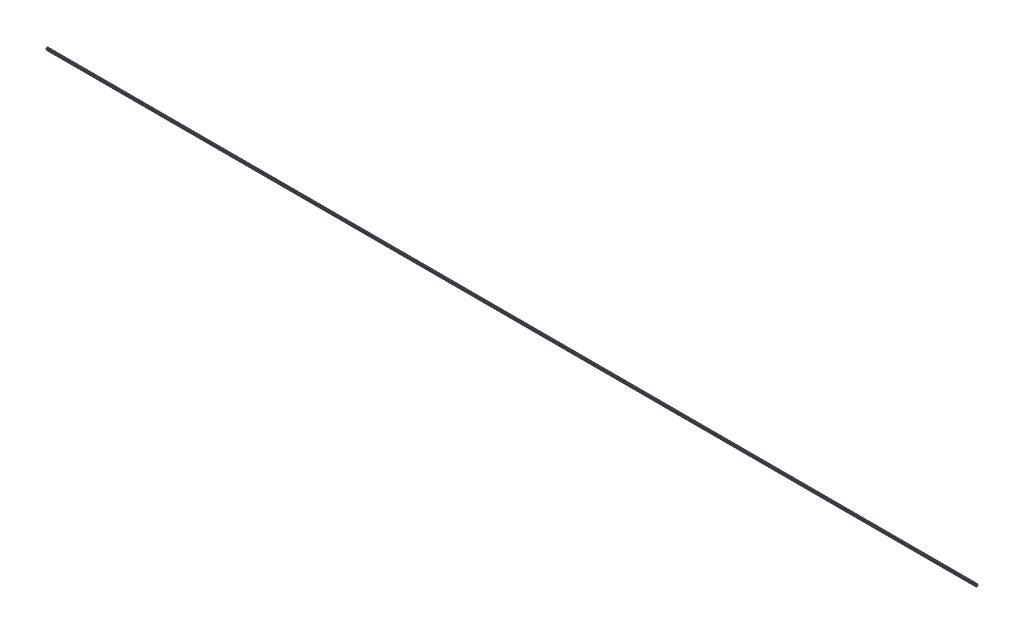
from build123d import *

# Parameters (mm, degrees)
SKETCH1_R           = 3.4
SKETCH1_R_2         = 2.1
BOSS_EXTRUDE1_DEPTH = 15000


with BuildPart() as part:
    # Sketch1 → Boss-Extrude1 (new body)
    with BuildSketch(Plane(origin=(0, 0, 0), x_dir=(0, -1, 0), z_dir=(-1, 0, 0))):
        with BuildLine():
            Line((13, -4), (13, -8.25))
            Line((13, -8.25), (9.664213562, -8.25))
            Line((9.664213562, -8.25), (6, -4.585786438))
            Line((6, -4.585786438), (6, -0.519615242))
            Line((6, -0.519615242), (5.7, 0))
            Line((5.7, 0), (6, 0.519615242))
            Line((6, 0.519615242), (6, 4.585786438))
            Line((6, 4.585786438), (9.664213562, 8.25))
            Line((9.664213562, 8.25), (13, 8.25))
            Line((13, 8.25), (13, 4))
            Line((13, 4), (15, 4))
            Line((15, 4), (15, 13))
            ThreePointArc((15, 13), (14.414213562, 14.414213562), (13, 15))
            Line((13, 15), (4, 15))
            Line((4, 15), (4, 13))
            Line((4, 13), (8.25, 13))
            Line((8.25, 13), (8.25, 9.664213562))
            Line((8.25, 9.664213562), (4.585786438, 6))
            Line((4.585786438, 6), (0.519615242, 6))
            Line((0.519615242, 6), (0, 5.7))
            Line((0, 5.7), (-0.519615242, 6))
            Line((-0.519615242, 6), (-4.585786438, 6))
            Line((-4.585786438, 6), (-8.25, 9.664213562))
            Line((-8.25, 9.664213562), (-8.25, 13))
            Line((-8.25, 13), (-4, 13))
            Line((-4, 13), (-4, 15))
            Line((-4, 15), (-13, 15))
            ThreePointArc((-13, 15), (-14.414213562, 14.414213562), (-15, 13))
            Line((-15, 13), (-15, 4))
            Line((-15, 4), (-13, 4))
            Line((-13, 4), (-13, 8.25))
            Line((-13, 8.25), (-9.664213562, 8.25))
            Line((-9.664213562, 8.25), (-6, 4.585786438))
            Line((-6, 4.585786438), (-6, 0.519615242))
            Line((-6, 0.519615242), (-5.7, 0))
            Line((-5.7, 0), (-6, -0.519615242))
            Line((-6, -0.519615242), (-6, -4.585786438))
            Line((-6, -4.585786438), (-9.664213562, -8.25))
            Line((-9.664213562, -8.25), (-13, -8.25))
            Line((-13, -8.25), (-13, -4))
            Line((-13, -4), (-15, -4))
            Line((-15, -4), (-15, -13))
            ThreePointArc((-15, -13), (-14.414213562, -14.414213562), (-13, -15))
            Line((-13, -15), (-4, -15))
            Line((-4, -15), (-4, -13))
            Line((-4, -13), (-8.25, -13))
            Line((-8.25, -13), (-8.25, -9.664213562))
            Line((-8.25, -9.664213562), (-4.585786438, -6))
            Line((-4.585786438, -6), (-0.519615242, -6))
            Line((-0.519615242, -6), (0, -5.7))
            Line((0, -5.7), (0.519615242, -6))
            Line((0.519615242, -6), (4.585786438, -6))
            Line((4.585786438, -6), (8.25, -9.664213562))
            Line((8.25, -9.664213562), (8.25, -13))
            Line((8.25, -13), (4, -13))
            Line((4, -13), (4, -15))
            Line((4, -15), (13, -15))
            ThreePointArc((13, -15), (14.414213562, -14.414213562), (15, -13))
            Line((15, -13), (15, -4))
            Line((15, -4), (13, -4))
        make_face()
        Circle(SKETCH1_R, mode=Mode.SUBTRACT)
        with Locations((11.6, -11.6)):
            Circle(SKETCH1_R_2, mode=Mode.SUBTRACT)
        with Locations((11.6, 11.6)):
            Circle(SKETCH1_R_2, mode=Mode.SUBTRACT)
        with Locations((-11.6, 11.6)):
            Circle(SKETCH1_R_2, mode=Mode.SUBTRACT)
        with Locations((-11.6, -11.6)):
            Circle(SKETCH1_R_2, mode=Mode.SUBTRACT)
    extrude(amount=-BOSS_EXTRUDE1_DEPTH)


solid = part.part
